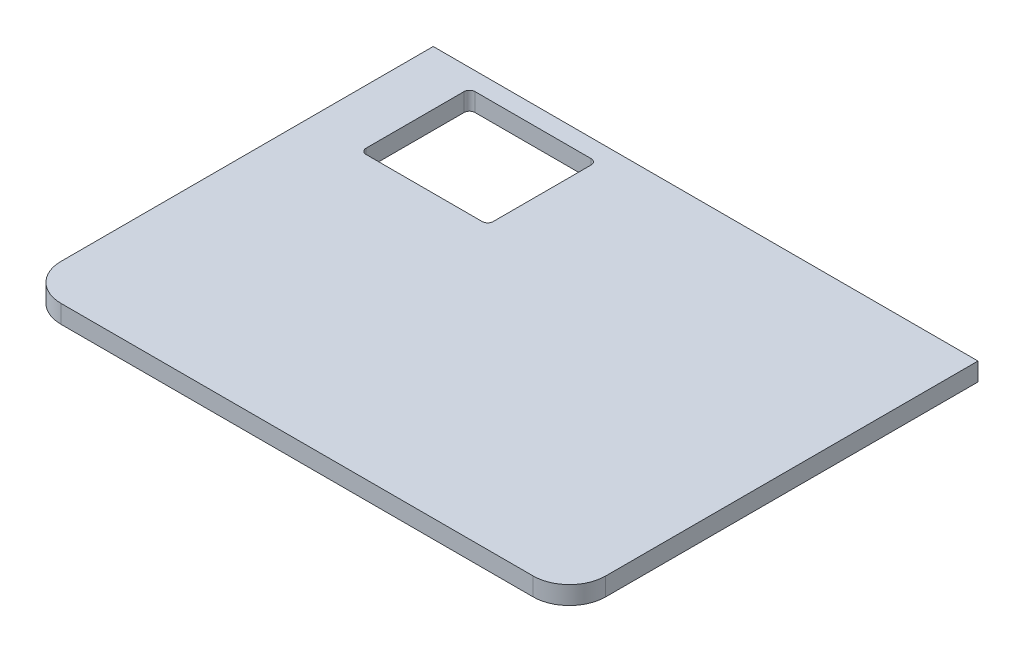
from build123d import *

# Parameters (mm, degrees)
LINEAR_AUSTRAGEN1_DEPTH         = 10
VERRUNDUNG1_R                   = 20
VERRUNDUNG1_OF_SPIEGELN2_R      = 20
SKIZZE3_W                       = 70
SKIZZE3_H                       = 60
SCHNITT_LINEAR_AUSTRAGEN1_DEPTH = 213.367605816
VERRUNDUNG2_R                   = 3


with BuildPart() as part:
    # Skizze1 → Linear austragen1 (new body)
    with BuildSketch(Plane(origin=(0, 0, 0), x_dir=(1, 0, 0), z_dir=(0, 1, 0))):
        Polygon((150, 75), (150, 150), (0, 150), (0, 75), (0, -75), (150, -75), align=None)
    linear_austragen1 = extrude(amount=LINEAR_AUSTRAGEN1_DEPTH)

    # Verrundung1
    verrundung1_edges = [part.edges().sort_by_distance(p)[0] for p in [
        (150, 5, 75),
    ]]
    fillet(verrundung1_edges, radius=VERRUNDUNG1_R)

    # Spiegeln2: Linear austragen1 across plane
    add(linear_austragen1.mirror(Plane(origin=(0, 10, -150), x_dir=(0, 0, 1), z_dir=(1, 0, 0))))

    # Verrundung1 of Spiegeln2
    verrundung1_of_spiegeln2_edges = [part.edges().sort_by_distance(p)[0] for p in [
        (-150, 5, 75),
    ]]
    fillet(verrundung1_of_spiegeln2_edges, radius=VERRUNDUNG1_OF_SPIEGELN2_R)

    # Skizze3 → Schnitt-Linear austragen1 (cut, through all)
    with BuildSketch(Plane(origin=(0, 0, 0), x_dir=(-1, 0, 0), z_dir=(0, 1, 0))):
        with Locations((85, -110)):
            Rectangle(SKIZZE3_W, SKIZZE3_H)
    extrude(amount=SCHNITT_LINEAR_AUSTRAGEN1_DEPTH, mode=Mode.SUBTRACT)

    # Verrundung2
    verrundung2_edges = [part.edges().sort_by_distance(p)[0] for p in [
        (-120, 5, -80),
        (-50, 5, -80),
        (-120, 5, -140),
        (-50, 5, -140),
    ]]
    fillet(verrundung2_edges, radius=VERRUNDUNG2_R)


solid = part.part
